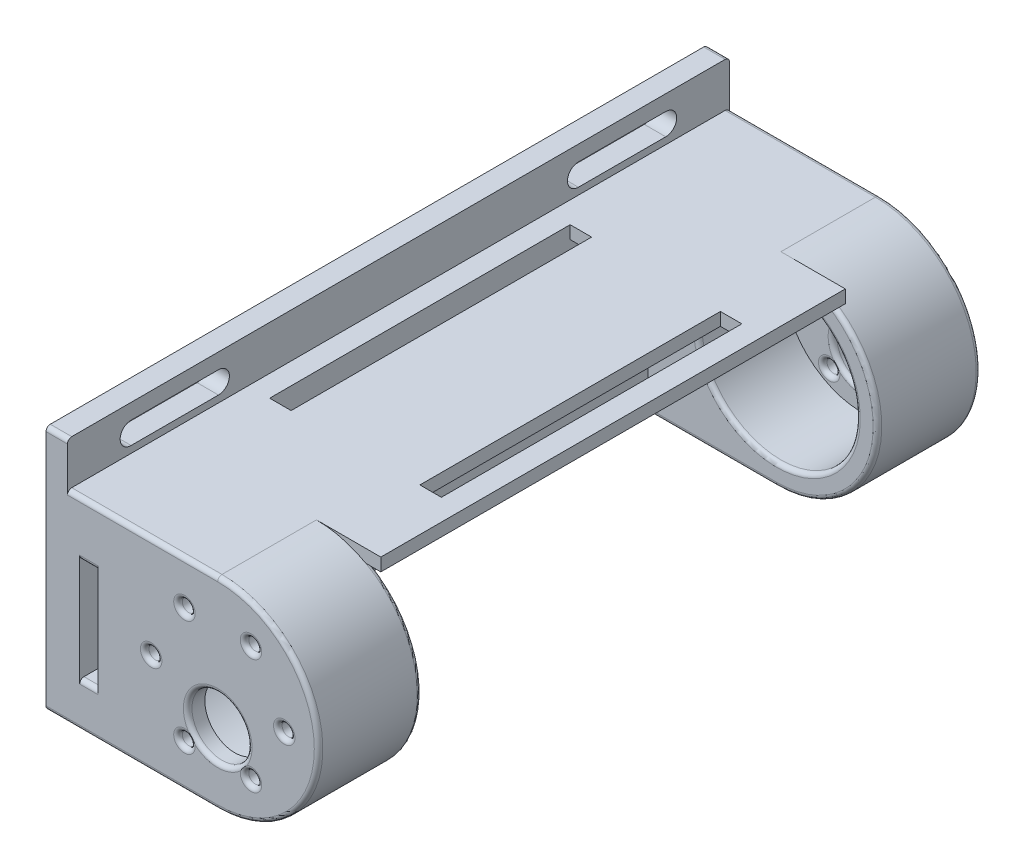
from build123d import *
from OCP.BRepFilletAPI import BRepFilletAPI_MakeChamfer

# Parameters (mm, degrees)
BOSS_EXTRUDE1_DEPTH = 20
BOSS_EXTRUDE2_START = 4
SKETCH1_3_R         = 7.0000000000000036
SKETCH1_3_R_2       = 1.5000000000000002
SKETCH1_3_R_3       = 1.5000000000000009
SKETCH1_3_R_4       = 1.5000000000000013
SKETCH1_3_R_5       = 1.500000000000008
SKETCH1_3_R_6       = 1.500000000000004
BOSS_EXTRUDE2_DEPTH = 4
BOSS_EXTRUDE3_DEPTH = 53.1
SKETCH5_W           = 20.000000000000007
SKETCH5_H           = 1.9999999999999991
SKETCH5_H_2         = 2.0000000000000018
SKETCH5_R           = 2.100000000000004
CUT_EXTRUDE1_DEPTH  = 20
FILLET1_R           = 1
CUT_EXTRUDE2_START  = -2.5
CUT_EXTRUDE2_DEPTH  = 22.5
FILLET2_R           = 1
FILLET3_R           = 1
BOSS_EXTRUDE5_START = -5
BOSS_EXTRUDE5_DEPTH = 5
CHAMFER1_SIZE       = 1.5
CHAMFER1_SIZE2      = 1.7876303888913219
BOSS_EXTRUDE6_DEPTH = 45
CUT_EXTRUDE3_DEPTH  = 3


# Read off the part's stored shape, not the designer's step: 37d-gearmotor-100-131-150-encoder.step
with BuildPart() as part:
    # Sketch1 → Boss-Extrude1 (new body)
    with BuildSketch(Plane.XY.offset(19.925000000000068)):
        with BuildLine():
            Line((-20.07500000000007, 23.500000000000004), (-20.07500000000007, -23.499999999999996))
            Line((-20.07500000000007, -23.499999999999996), (19.92499999999993, -23.500000000000004))
            ThreePointArc((19.924999999999926, -23.500000000000007), (-3.575000000000081, 6.35e-15), (19.92499999999992, 23.500000000000014))
            Line((19.924999999999923, 23.500000000000004), (-20.07500000000007, 23.500000000000004))
        make_face()
        with BuildLine():
            ThreePointArc((19.92499999999992, 23.500000000000014), (-3.575000000000081, 6.35e-15), (19.924999999999926, -23.500000000000007))
            Line((19.92499999999993, -23.500000000000004), (19.92499999999993, -18.500000000000004))
            ThreePointArc((19.92499999999945, -18.500000000000004), (1.4249999999999226, 5.74e-15), (19.924999999999464, 18.50000000000001))
            Line((19.924999999999923, 18.50000000000001), (19.924999999999923, 23.500000000000004))
        make_face()
        with BuildLine():
            Line((19.92499999999993, -18.500000000000004), (19.92499999999993, -23.500000000000004))
            ThreePointArc((19.924999999999926, -23.500000000000007), (36.5420093578838, -16.617009357883873), (43.42499999999994, -2.29e-15))
            ThreePointArc((43.42499999999994, 3.47e-15), (36.5420093578838, 16.61700935788388), (19.924999999999926, 23.500000000000014))
            Line((19.924999999999923, 23.500000000000004), (19.924999999999923, 18.50000000000001))
            ThreePointArc((19.924999999999464, 18.50000000000001), (33.0064754519509, 13.081475451951302), (38.42499999999994, 3.47e-15))
            ThreePointArc((38.42499999999994, -1.06e-15), (33.006475451950884, -13.081475451951308), (19.92499999999945, -18.500000000000004))
        make_face()
    extrude(amount=-BOSS_EXTRUDE1_DEPTH)

    # Sketch1<3> → Boss-Extrude2 (add)
    with BuildSketch(Plane.XY.offset(19.925000000000068).offset(BOSS_EXTRUDE2_START)):
        with BuildLine():
            Line((-20.07500000000007, 23.500000000000004), (-20.07500000000007, -23.499999999999996))
            Line((-20.07500000000007, -23.499999999999996), (19.92499999999993, -23.500000000000004))
            ThreePointArc((19.92499999999993, -23.500000000000007), (43.42499999999994, 7.25e-15), (19.924999999999923, 23.500000000000014))
            Line((19.924999999999923, 23.500000000000004), (-20.07500000000007, 23.500000000000004))
        make_face()
        with Locations((19.924999999999926, -7.000000000000003)):
            Circle(SKETCH1_3_R, mode=Mode.SUBTRACT)
        with Locations((12.175000000000061, 13.423393758658873)):
            Circle(SKETCH1_3_R_2, mode=Mode.SUBTRACT)
        with Locations((12.17499999999986, -13.42339375865876)):
            Circle(SKETCH1_3_R_3, mode=Mode.SUBTRACT)
        with Locations((4.424999999999929, 1.1319e-13)):
            Circle(SKETCH1_3_R_4, mode=Mode.SUBTRACT)
        with Locations((27.674999999999894, -13.423393758658815)):
            Circle(SKETCH1_3_R_5, mode=Mode.SUBTRACT)
        with Locations((35.424999999999926, 1.19e-15)):
            Circle(SKETCH1_3_R_6, mode=Mode.SUBTRACT)
        with Locations((27.67500000000009, 13.423393758658715)):
            Circle(SKETCH1_3_R_5, mode=Mode.SUBTRACT)
    extrude(amount=-BOSS_EXTRUDE2_DEPTH)

    # Sketch3 → Boss-Extrude3 (add)
    with BuildSketch(Plane(origin=(0, 0, -0.07499999999993276), x_dir=(-1, 0, 0), z_dir=(0, 0, -1))):
        Polygon((20.075000000000003, 23.500000000000004), (10.075000000000003, 23.500000000000004), (10.075000000000008, -23.499999999999996), (20.07500000000001, -23.499999999999996), align=None)
    extrude(amount=BOSS_EXTRUDE3_DEPTH)

    # Mirror12: part across plane


with BuildPart() as part_1:
    add(part.part)
    add(part.part.mirror(Plane(origin=(-1.8566e-13, 0, -53.17499999999993), x_dir=(1, 0, -3.49e-15), z_dir=(-3.49e-15, 0, -1))))

    # Sketch5 → Cut-Extrude1 (cut)
    with BuildSketch(Plane.ZY.offset(20.075000000000003)):
        with BuildLine():
            ThreePointArc((-117.17499999999998, 4.199999999999996), (-115.69007575950818, 4.8150757595082165), (-115.07499999999989, 6.299999999999999))
            Line((-115.07499999999989, 6.3), (-117.1749999999999, 6.3))
            Line((-117.1749999999999, 6.300000000000001), (-117.1749999999999, 4.199999999999996))
        make_face()
        with BuildLine():
            Line((-117.1749999999999, 6.3), (-115.07499999999989, 6.3))
            ThreePointArc((-115.07499999999989, 6.3), (-118.65992424049162, 7.784924240491783), (-117.17499999999998, 4.199999999999996))
            Line((-117.1749999999999, 4.199999999999996), (-117.1749999999999, 6.300000000000001))
        make_face()
        with BuildLine():
            ThreePointArc((12.9250000000001, 6.3), (10.825000000000099, 8.4), (8.725000000000097, 6.3))
            Line((8.725000000000094, 6.3), (10.825000000000102, 6.3))
            Line((10.825000000000099, 6.300000000000001), (10.825000000000099, 4.199999999999999))
            ThreePointArc((10.82500000000018, 4.199999999999999), (12.309924240491878, 4.815075759508279), (12.9250000000001, 6.299999999999999))
        make_face()
        with BuildLine():
            Line((10.825000000000102, 6.3), (8.725000000000094, 6.3))
            ThreePointArc((8.725000000000097, 6.3), (9.340075759508377, 4.815075759508221), (10.82500000000018, 4.199999999999999))
            Line((10.825000000000099, 4.199999999999999), (10.825000000000099, 6.300000000000001))
        make_face()
        with BuildLine():
            ThreePointArc((12.9250000000001, -8.7), (12.309924240491878, -7.215075759508277), (10.825000000000179, -6.599999999999998))
            Line((10.825000000000099, -6.599999999999998), (10.825000000000099, -8.7))
            Line((10.825000000000102, -8.7), (8.725000000000094, -8.7))
            ThreePointArc((8.725000000000097, -8.7), (10.825000000000099, -10.8), (12.9250000000001, -8.7))
        make_face()
        with BuildLine():
            Line((10.825000000000099, -8.7), (10.825000000000099, -6.599999999999998))
            ThreePointArc((10.825000000000179, -6.599999999999998), (9.340075759508377, -7.21507575950822), (8.725000000000097, -8.7))
            Line((8.725000000000094, -8.7), (10.825000000000102, -8.7))
        make_face()
        Polygon((-43.17499999999989, 8.3), (-63.1749999999999, 8.3), (-63.17499999999989, 6.3), (-43.1749999999999, 6.3), align=None)
        Polygon((-43.1749999999999, 6.3), (-63.17499999999989, 6.3), (-63.17499999999988, 4.3), (-43.17499999999989, 4.3), align=None)
        with Locations((-53.1749999999999, -7.699999999999999)):
            Rectangle(SKETCH5_W, SKETCH5_H)
        with Locations((-53.1749999999999, -9.7)):
            Rectangle(SKETCH5_W, SKETCH5_H_2)
        with Locations((-117.1749999999999, -8.7)):
            Circle(SKETCH5_R)
    extrude(amount=-CUT_EXTRUDE1_DEPTH, mode=Mode.SUBTRACT)

    # Fillet1
    # the kernel refuses this fillet: 1 mm, written as the material it adds along each edge
    with BuildSketch(Plane(origin=(-20.075000000000003, -6.700000000000001, -43.1749999999999), x_dir=(0, -1, 0), z_dir=(1, 0, 0)), Plane(origin=(-20.075000000000003, -10.700000000000001, -63.1749999999999), x_dir=(0, 1, 0), z_dir=(1, 0, 0))) as fillet1_piece_1:
        with BuildLine():
            CenterArc((FILLET1_R, FILLET1_R), FILLET1_R, 180, 90)
            Line((0, FILLET1_R), (0, 0))
            Line((0, 0), (FILLET1_R, 0))
        make_face()
    extrude(amount=9.999999999999996)
    with BuildSketch(Plane(origin=(-20.075000000000003, -10.700000000000001, -43.1749999999999), x_dir=(0, 0, -1), z_dir=(1, 0, 0))) as fillet1_piece_2:
        with BuildLine():
            CenterArc((FILLET1_R, FILLET1_R), FILLET1_R, 180, 90)
            Line((0, FILLET1_R), (0, 0))
            Line((0, 0), (FILLET1_R, 0))
        make_face()
    extrude(amount=9.999999999999996)
    with BuildSketch(Plane(origin=(-20.075000000000003, -6.700000000000001, -63.1749999999999), x_dir=(0, -1, 0), z_dir=(1, 0, 0))) as fillet1_piece_3:
        with BuildLine():
            CenterArc((FILLET1_R, -FILLET1_R), FILLET1_R, 90, 90)
            Line((0, -FILLET1_R), (0, 0))
            Line((0, 0), (FILLET1_R, 0))
        make_face()
    extrude(amount=9.999999999999996)
    with BuildSketch(Plane(origin=(-20.075000000000003, 8.3, -43.17499999999989), x_dir=(0, -1, 0), z_dir=(1, 0, 0))) as fillet1_piece_4:
        with BuildLine():
            CenterArc((FILLET1_R, FILLET1_R), FILLET1_R, 180, 90)
            Line((0, FILLET1_R), (0, 0))
            Line((0, 0), (FILLET1_R, 0))
        make_face()
    extrude(amount=9.999999999999998)
    with BuildSketch(Plane(origin=(-20.075000000000003, 4.3, -43.17499999999989), x_dir=(0, 1, 0), z_dir=(1, 0, 0))) as fillet1_piece_5:
        with BuildLine():
            CenterArc((FILLET1_R, -FILLET1_R), FILLET1_R, 90, 90)
            Line((0, -FILLET1_R), (0, 0))
            Line((0, 0), (FILLET1_R, 0))
        make_face()
    extrude(amount=9.999999999999998)
    with BuildSketch(Plane(origin=(-20.075000000000003, 4.3, -63.17499999999988), x_dir=(0, 1, 0), z_dir=(1, 0, 0))) as fillet1_piece_6:
        with BuildLine():
            CenterArc((FILLET1_R, FILLET1_R), FILLET1_R, 180.0000000000004, 89.99999999999943)
            Line((8.9e-16, FILLET1_R), (0, 0))
            Line((0, 0), (FILLET1_R, 0))
        make_face()
    extrude(amount=9.999999999999998)
    with BuildSketch(Plane(origin=(-20.075000000000003, 8.3, -63.1749999999999), x_dir=(0, 0, 1), z_dir=(1, 0, 0))) as fillet1_piece_7:
        with BuildLine():
            CenterArc((FILLET1_R, FILLET1_R), FILLET1_R, 179.99999999999986, 90.00000000000011)
            Line((0, FILLET1_R), (0, 0))
            Line((0, 0), (FILLET1_R, 0))
        make_face()
    extrude(amount=9.999999999999998)
    # the kernel refuses this fillet: 1 mm, written as the material it takes off along each edge
    with BuildSketch(Plane(origin=(35.425, 1.19e-15, 19.925000000000068), x_dir=(1, 0, 0), z_dir=(0, -1, 0))) as fillet1_2_piece_1:
        with BuildLine():
            CenterArc((1.500000000000007 + FILLET1_R, FILLET1_R), FILLET1_R, 180, 90)
            Line((1.500000000000007 + FILLET1_R, 0), (1.500000000000007, 0))
            Line((1.500000000000007, 0), (1.500000000000007, FILLET1_R))
        make_face()
    revolve(axis=Axis((35.425, 1.19e-15, 19.925000000000068), (0, 0, 1)), mode=Mode.SUBTRACT)
    with BuildSketch(Plane(origin=(27.674999999999965, -13.423393758658815, 19.925000000000068), x_dir=(1, 0, 0), z_dir=(0, -1, 0))) as fillet1_2_piece_2:
        with BuildLine():
            CenterArc((1.500000000000007 + FILLET1_R, FILLET1_R), FILLET1_R, 180, 90)
            Line((1.500000000000007 + FILLET1_R, 0), (1.500000000000007, 0))
            Line((1.500000000000007, 0), (1.500000000000007, FILLET1_R))
        make_face()
    revolve(axis=Axis((27.674999999999965, -13.423393758658815, 19.925000000000068), (0, 0, 1)), mode=Mode.SUBTRACT)
    with BuildSketch(Plane(origin=(27.67500000000016, 13.423393758658715, 19.925000000000068), x_dir=(1, 0, 0), z_dir=(0, -1, 0))) as fillet1_2_piece_3:
        with BuildLine():
            CenterArc((1.500000000000007 + FILLET1_R, FILLET1_R), FILLET1_R, 180, 90)
            Line((1.500000000000007 + FILLET1_R, 0), (1.500000000000007, 0))
            Line((1.500000000000007, 0), (1.500000000000007, FILLET1_R))
        make_face()
    revolve(axis=Axis((27.67500000000016, 13.423393758658715, 19.925000000000068), (0, 0, 1)), mode=Mode.SUBTRACT)
    with BuildSketch(Plane(origin=(4.424999999999998, 1.1319e-13, 19.925000000000068), x_dir=(1, 0, 0), z_dir=(0, -1, 0))) as fillet1_2_piece_4:
        with BuildLine():
            CenterArc((1.5000000000000009 + FILLET1_R, FILLET1_R), FILLET1_R, 180, 90)
            Line((1.5000000000000009 + FILLET1_R, 0), (1.5000000000000009, 0))
            Line((1.5000000000000009, 0), (1.5000000000000009, FILLET1_R))
        make_face()
    revolve(axis=Axis((4.424999999999998, 1.1319e-13, 19.925000000000068), (0, 0, 1)), mode=Mode.SUBTRACT)
    with BuildSketch(Plane(origin=(12.17500000000013, 13.423393758658873, 19.925000000000068), x_dir=(1, 0, 0), z_dir=(0, -1, 0))) as fillet1_2_piece_5:
        with BuildLine():
            CenterArc((1.5 + FILLET1_R, FILLET1_R), FILLET1_R, 180, 90)
            Line((1.5 + FILLET1_R, 0), (1.5, 0))
            Line((1.5, 0), (1.5, FILLET1_R))
        make_face()
    revolve(axis=Axis((12.17500000000013, 13.423393758658873, 19.925000000000068), (0, 0, 1)), mode=Mode.SUBTRACT)
    with BuildSketch(Plane(origin=(19.924999999999994, 23.500000000000004, 23.925000000000068), x_dir=(0, 0, -1), z_dir=(-1, 0, 0))) as fillet1_2_piece_6:
        with BuildLine():
            CenterArc((FILLET1_R, FILLET1_R), FILLET1_R, 180, 90)
            Line((0, FILLET1_R), (0, 0))
            Line((0, 0), (FILLET1_R, 0))
        make_face()
    extrude(amount=42.49999999999999, mode=Mode.SUBTRACT)
    with BuildSketch(Plane(origin=(27.674999999999965, -13.423393758658815, 23.925000000000068), x_dir=(1, 0, 0), z_dir=(0, -1, 0))) as fillet1_2_piece_7:
        with BuildLine():
            CenterArc((1.500000000000007 + FILLET1_R, -FILLET1_R), FILLET1_R, 90, 90)
            Line((1.500000000000007, -FILLET1_R), (1.500000000000007, 0))
            Line((1.500000000000007, 0), (1.500000000000007 + FILLET1_R, 0))
        make_face()
    revolve(axis=Axis((27.674999999999965, -13.423393758658815, 23.925000000000068), (0, 0, 1)), mode=Mode.SUBTRACT)
    with BuildSketch(Plane(origin=(27.67500000000016, 13.423393758658715, 23.925000000000068), x_dir=(1, 0, 0), z_dir=(0, -1, 0))) as fillet1_2_piece_8:
        with BuildLine():
            CenterArc((1.500000000000007 + FILLET1_R, -FILLET1_R), FILLET1_R, 90, 90)
            Line((1.500000000000007, -FILLET1_R), (1.500000000000007, 0))
            Line((1.500000000000007, 0), (1.500000000000007 + FILLET1_R, 0))
        make_face()
    revolve(axis=Axis((27.67500000000016, 13.423393758658715, 23.925000000000068), (0, 0, 1)), mode=Mode.SUBTRACT)
    with BuildSketch(Plane(origin=(12.17499999999993, -13.42339375865876, 23.925000000000068), x_dir=(1, 0, 0), z_dir=(0, -1, 0))) as fillet1_2_piece_9:
        with BuildLine():
            CenterArc((1.5000000000000018 + FILLET1_R, -FILLET1_R), FILLET1_R, 90, 90)
            Line((1.5000000000000018, -FILLET1_R), (1.5000000000000018, 0))
            Line((1.5000000000000018, 0), (1.5000000000000018 + FILLET1_R, 0))
        make_face()
    revolve(axis=Axis((12.17499999999993, -13.42339375865876, 23.925000000000068), (0, 0, 1)), mode=Mode.SUBTRACT)
    with BuildSketch(Plane(origin=(4.424999999999998, 1.1319e-13, 23.925000000000068), x_dir=(1, 0, 0), z_dir=(0, -1, 0))) as fillet1_2_piece_10:
        with BuildLine():
            CenterArc((1.5000000000000009 + FILLET1_R, -FILLET1_R), FILLET1_R, 90, 90)
            Line((1.5000000000000009, -FILLET1_R), (1.5000000000000009, 0))
            Line((1.5000000000000009, 0), (1.5000000000000009 + FILLET1_R, 0))
        make_face()
    revolve(axis=Axis((4.424999999999998, 1.1319e-13, 23.925000000000068), (0, 0, 1)), mode=Mode.SUBTRACT)
    with BuildSketch(Plane(origin=(12.17500000000013, 13.423393758658873, 23.925000000000068), x_dir=(1, 0, 0), z_dir=(0, -1, 0))) as fillet1_2_piece_11:
        with BuildLine():
            CenterArc((1.5 + FILLET1_R, -FILLET1_R), FILLET1_R, 90, 90)
            Line((1.5, -FILLET1_R), (1.5, 0))
            Line((1.5, 0), (1.5 + FILLET1_R, 0))
        make_face()
    revolve(axis=Axis((12.17500000000013, 13.423393758658873, 23.925000000000068), (0, 0, 1)), mode=Mode.SUBTRACT)
    with BuildSketch(Plane(origin=(19.924999999999997, -7.000000000000003, 23.925000000000068), x_dir=(1, 0, 0), z_dir=(0, -1, 0))) as fillet1_2_piece_12:
        with BuildLine():
            CenterArc((7.000000000000007 + FILLET1_R, -FILLET1_R), FILLET1_R, 90, 90)
            Line((7.000000000000007, -FILLET1_R), (7.000000000000007, 0))
            Line((7.000000000000007, 0), (7.000000000000007 + FILLET1_R, 0))
        make_face()
    revolve(axis=Axis((19.924999999999997, -7.000000000000003, 23.925000000000068), (0, 0, 1)), mode=Mode.SUBTRACT)
    with BuildSketch(Plane(origin=(35.425, 1.19e-15, 23.925000000000068), x_dir=(1, 0, 0), z_dir=(0, -1, 0))) as fillet1_2_piece_13:
        with BuildLine():
            CenterArc((1.500000000000007 + FILLET1_R, -FILLET1_R), FILLET1_R, 90, 90)
            Line((1.500000000000007, -FILLET1_R), (1.500000000000007, 0))
            Line((1.500000000000007, 0), (1.500000000000007 + FILLET1_R, 0))
        make_face()
    revolve(axis=Axis((35.425, 1.19e-15, 23.925000000000068), (0, 0, 1)), mode=Mode.SUBTRACT)
    with BuildSketch(Plane(origin=(19.925000000000004, 2.66e-15, 23.925000000000068), x_dir=(-1.5e-16, -1, 0), z_dir=(-1, 1.5e-16, 0))) as fillet1_2_piece_14:
        with BuildLine():
            CenterArc((23.500000000000007 - FILLET1_R, -FILLET1_R), FILLET1_R, 0, 90)
            Line((23.500000000000007, -FILLET1_R), (23.500000000000007, 0))
            Line((23.500000000000007, 0), (23.500000000000007 - FILLET1_R, 0))
        make_face()
    revolve(axis=Axis((19.925000000000004, 2.66e-15, 23.925000000000068), (0, 0, 1)), revolution_arc=180.00000000000003, mode=Mode.SUBTRACT)
    with BuildSketch(Plane(origin=(-22.575, -23.499999999999996, 23.925000000000068), x_dir=(1.8e-16, 1, 0), z_dir=(1, -1.8e-16, 0))) as fillet1_2_piece_15:
        with BuildLine():
            CenterArc((FILLET1_R, -FILLET1_R), FILLET1_R, 90, 90)
            Line((0, -FILLET1_R), (0, 0))
            Line((0, 0), (FILLET1_R, 0))
        make_face()
    extrude(amount=42.5, mode=Mode.SUBTRACT)
    with BuildSketch(Plane(origin=(19.924999999999997, -7.11e-15, -0.07499999999993179), x_dir=(-1.248e-14, -1, 0), z_dir=(-1, 1.248e-14, 0))) as fillet1_2_piece_16:
        with BuildLine():
            CenterArc((18.500000000000014 + FILLET1_R, FILLET1_R), FILLET1_R, 180, 90)
            Line((18.500000000000014, FILLET1_R), (18.500000000000014, 0))
            Line((18.500000000000014, 0), (18.500000000000014 + FILLET1_R, 0))
        make_face()
    revolve(axis=Axis((19.924999999999997, -7.11e-15, -0.07499999999993179), (0, 0, 1)), mode=Mode.SUBTRACT)
    with BuildSketch(Plane(origin=(-10.07500000000001, -23.499999999999996, -0.07499999999993179), x_dir=(1.8e-16, 1, 0), z_dir=(1, -1.8e-16, 0))) as fillet1_2_piece_17:
        with BuildLine():
            CenterArc((FILLET1_R, FILLET1_R), FILLET1_R, 180, 90)
            Line((0, FILLET1_R), (0, 0))
            Line((0, 0), (FILLET1_R, 0))
        make_face()
    extrude(amount=30.00000000000001, mode=Mode.SUBTRACT)
    with BuildSketch(Plane(origin=(19.924999999999994, 23.500000000000004, -0.07499999999993179), x_dir=(0, 0, 1), z_dir=(-1, 0, 0))) as fillet1_2_piece_18:
        with BuildLine():
            CenterArc((FILLET1_R, -FILLET1_R), FILLET1_R, 90, 90)
            Line((0, -FILLET1_R), (0, 0))
            Line((0, 0), (FILLET1_R, 0))
        make_face()
    extrude(amount=30, mode=Mode.SUBTRACT)
    with BuildSketch(Plane(origin=(19.924999999999997, 9.77e-15, -0.07499999999993179), x_dir=(0, -1, 0), z_dir=(-1, 0, 0))) as fillet1_2_piece_19:
        with BuildLine():
            CenterArc((23.500000000000014 - FILLET1_R, FILLET1_R), FILLET1_R, 270, 90)
            Line((23.500000000000014, FILLET1_R), (23.500000000000014, 0))
            Line((23.500000000000014, 0), (23.500000000000014 - FILLET1_R, 0))
        make_face()
    revolve(axis=Axis((19.924999999999997, 9.77e-15, -0.07499999999993179), (0, 0, 1)), revolution_arc=180, mode=Mode.SUBTRACT)
    with BuildSketch(Plane(origin=(-10.07500000000038, -23.499999999999996, -106.27499999999986), x_dir=(1.8e-16, 1, -1.421e-14), z_dir=(1, -1.8e-16, -6.98e-15))) as fillet1_2_piece_20:
        with BuildLine():
            CenterArc((FILLET1_R, -FILLET1_R), FILLET1_R, 90.00000000000081, 89.99999999999919)
            Line((1.421e-14, -FILLET1_R), (0, 0))
            Line((0, 0), (FILLET1_R, 0))
        make_face()
    extrude(amount=30.00000000000001, mode=Mode.SUBTRACT)
    with BuildSketch(Plane(origin=(19.924999999999624, 9.77e-15, -106.27500000000008), x_dir=(0, -1, 0), z_dir=(-1, 0, 6.98e-15))) as fillet1_2_piece_21:
        with BuildLine():
            CenterArc((23.500000000000018 - FILLET1_R, -FILLET1_R), FILLET1_R, 359.9999999999992, 90.0000000000008)
            Line((23.500000000000018, -FILLET1_R), (23.500000000000018, 0))
            Line((23.500000000000018, 0), (23.500000000000018 - FILLET1_R, 0))
        make_face()
    revolve(axis=Axis((19.924999999999624, 9.77e-15, -106.27500000000008), (6.98e-15, 0, 1)), revolution_arc=180, mode=Mode.SUBTRACT)
    with BuildSketch(Plane(origin=(19.924999999999464, 2.66e-15, -130.27500000000006), x_dir=(-1.5e-16, -1, 0), z_dir=(-1, 1.5e-16, 6.98e-15))) as fillet1_2_piece_22:
        with BuildLine():
            CenterArc((23.500000000000007 - FILLET1_R, FILLET1_R), FILLET1_R, 269.9999999999996, 90.0000000000004)
            Line((23.500000000000007 - FILLET1_R, 0), (23.500000000000007, 0))
            Line((23.500000000000007, 0), (23.500000000000014, FILLET1_R))
        make_face()
    revolve(axis=Axis((19.924999999999464, 2.66e-15, -130.27500000000006), (6.98e-15, 0, 1)), revolution_arc=180.00000000000003, mode=Mode.SUBTRACT)
    with BuildSketch(Plane(origin=(-22.57500000000054, -23.499999999999996, -130.27499999999975), x_dir=(1.8e-16, 1, 0), z_dir=(1, -1.8e-16, -6.98e-15))) as fillet1_2_piece_23:
        with BuildLine():
            CenterArc((FILLET1_R, FILLET1_R), FILLET1_R, 180, 90)
            Line((0, FILLET1_R), (0, 0))
            Line((0, 0), (FILLET1_R, 0))
        make_face()
    extrude(amount=42.5, mode=Mode.SUBTRACT)
    with BuildSketch(Plane(origin=(19.924999999999624, 23.500000000000004, -106.27500000000008), x_dir=(-6.98e-15, 0, -1), z_dir=(-1, 0, 6.98e-15))) as fillet1_2_piece_24:
        with BuildLine():
            CenterArc((FILLET1_R, FILLET1_R), FILLET1_R, 180, 90)
            Line((0, FILLET1_R), (0, 0))
            Line((0, 0), (FILLET1_R, 0))
        make_face()
    extrude(amount=30, mode=Mode.SUBTRACT)
    with BuildSketch(Plane(origin=(19.924999999999624, -7.11e-15, -106.27500000000008), x_dir=(-1.248e-14, -1, 0), z_dir=(-1, 1.248e-14, 6.98e-15))) as fillet1_2_piece_25:
        with BuildLine():
            CenterArc((18.500000000000014 + FILLET1_R, -FILLET1_R), FILLET1_R, 90, 90)
            Line((18.500000000000014, -FILLET1_R), (18.500000000000014, 0))
            Line((18.500000000000014, 0), (18.500000000000014 + FILLET1_R, 0))
        make_face()
    revolve(axis=Axis((19.924999999999624, -7.11e-15, -106.27500000000008), (6.98e-15, 0, 1)), mode=Mode.SUBTRACT)
    with BuildSketch(Plane(origin=(27.674999999999454, -13.423393758658815, -126.27500000000012), x_dir=(1, 0, 0), z_dir=(0, -1, 0))) as fillet1_2_piece_26:
        with BuildLine():
            CenterArc((1.500000000000007 + FILLET1_R, -FILLET1_R), FILLET1_R, 89.99999999999959, 89.9999999999996)
            Line((1.500000000000007 + FILLET1_R, -2.842e-14), (1.500000000000007, -1.421e-14))
            Line((1.500000000000007, -1.421e-14), (1.5, -FILLET1_R))
        make_face()
    revolve(axis=Axis((27.674999999999454, -13.423393758658815, -126.27500000000012), (6.98e-15, 0, 1)), mode=Mode.SUBTRACT)
    with BuildSketch(Plane(origin=(27.67499999999965, 13.423393758658715, -126.27500000000012), x_dir=(1, 0, 0), z_dir=(0, -1, 0))) as fillet1_2_piece_27:
        with BuildLine():
            CenterArc((1.500000000000007 + FILLET1_R, -FILLET1_R), FILLET1_R, 89.99999999999959, 89.9999999999996)
            Line((1.500000000000007 + FILLET1_R, -2.842e-14), (1.500000000000007, -1.421e-14))
            Line((1.500000000000007, -1.421e-14), (1.5, -FILLET1_R))
        make_face()
    revolve(axis=Axis((27.67499999999965, 13.423393758658715, -126.27500000000012), (6.98e-15, 0, 1)), mode=Mode.SUBTRACT)
    with BuildSketch(Plane(origin=(12.17499999999942, -13.42339375865876, -126.275), x_dir=(1, 0, 0), z_dir=(0, -1, 0))) as fillet1_2_piece_28:
        with BuildLine():
            CenterArc((1.5 + FILLET1_R, -FILLET1_R), FILLET1_R, 89.99999999999959, 89.9999999999996)
            Line((1.5 + FILLET1_R, -2.842e-14), (1.5, -1.421e-14))
            Line((1.5, -1.421e-14), (1.4999999999999947, -FILLET1_R))
        make_face()
    revolve(axis=Axis((12.17499999999942, -13.42339375865876, -126.275), (6.98e-15, 0, 1)), mode=Mode.SUBTRACT)
    with BuildSketch(Plane(origin=(4.424999999999487, 1.1319e-13, -126.27499999999995), x_dir=(1, 0, 0), z_dir=(0, -1, 0))) as fillet1_2_piece_29:
        with BuildLine():
            CenterArc((1.5000000000000009 + FILLET1_R, -FILLET1_R), FILLET1_R, 89.99999999999964, 89.99999999999955)
            Line((1.5000000000000009 + FILLET1_R, -2.842e-14), (1.5000000000000009, -1.421e-14))
            Line((1.5000000000000009, -1.421e-14), (1.4999999999999938, -FILLET1_R))
        make_face()
    revolve(axis=Axis((4.424999999999487, 1.1319e-13, -126.27499999999995), (6.98e-15, 0, 1)), mode=Mode.SUBTRACT)
    with BuildSketch(Plane(origin=(12.17499999999962, 13.423393758658873, -126.275), x_dir=(1, 0, 0), z_dir=(0, -1, 0))) as fillet1_2_piece_30:
        with BuildLine():
            CenterArc((1.5 + FILLET1_R, -FILLET1_R), FILLET1_R, 89.99999999999959, 89.9999999999996)
            Line((1.5 + FILLET1_R, -2.842e-14), (1.5, -1.421e-14))
            Line((1.5, -1.421e-14), (1.499999999999993, -FILLET1_R))
        make_face()
    revolve(axis=Axis((12.17499999999962, 13.423393758658873, -126.275), (6.98e-15, 0, 1)), mode=Mode.SUBTRACT)
    with BuildSketch(Plane(origin=(19.924999999999486, -7.000000000000003, -126.27500000000006), x_dir=(1, 0, -8.12e-15), z_dir=(0, -1, 0))) as fillet1_2_piece_31:
        with BuildLine():
            CenterArc((7.000000000000007 + FILLET1_R, -FILLET1_R), FILLET1_R, 89.9999999999999, 89.99999999999977)
            Line((7.000000000000007 + FILLET1_R, -6.09e-15), (7.000000000000007, 1.421e-14))
            Line((7.000000000000007, 1.421e-14), (7.000000000000004, -FILLET1_R))
        make_face()
    revolve(axis=Axis((19.924999999999486, -7.000000000000003, -126.27500000000006), (6.98e-15, 0, 1)), mode=Mode.SUBTRACT)
    with BuildSketch(Plane(origin=(35.424999999999486, 1.19e-15, -126.27500000000018), x_dir=(1, 0, 0), z_dir=(0, -1, 0))) as fillet1_2_piece_32:
        with BuildLine():
            CenterArc((1.500000000000007 + FILLET1_R, -FILLET1_R), FILLET1_R, 89.99999999999959, 89.9999999999996)
            Line((1.500000000000007 + FILLET1_R, -2.842e-14), (1.500000000000007, -1.421e-14))
            Line((1.500000000000007, -1.421e-14), (1.5, -FILLET1_R))
        make_face()
    revolve(axis=Axis((35.424999999999486, 1.19e-15, -126.27500000000018), (6.98e-15, 0, 1)), mode=Mode.SUBTRACT)
    with BuildSketch(Plane(origin=(19.924999999999457, -7.000000000000003, -130.27500000000006), x_dir=(1, 0, -8.12e-15), z_dir=(0, -1, 0))) as fillet1_2_piece_33:
        with BuildLine():
            CenterArc((7.000000000000007 + FILLET1_R, FILLET1_R), FILLET1_R, 179.99999999999886, 90.00000000000125)
            Line((7.000000000000006, FILLET1_R), (7.000000000000007, 2.842e-14))
            Line((7.000000000000007, 2.842e-14), (7.000000000000007 + FILLET1_R, 8.12e-15))
        make_face()
    revolve(axis=Axis((19.924999999999457, -7.000000000000003, -130.27500000000006), (6.98e-15, 0, 1)), mode=Mode.SUBTRACT)
    with BuildSketch(Plane(origin=(19.924999999999454, 23.500000000000004, -130.27500000000006), x_dir=(6.98e-15, 0, 1), z_dir=(-1, 0, 6.98e-15))) as fillet1_2_piece_34:
        with BuildLine():
            CenterArc((FILLET1_R, -FILLET1_R), FILLET1_R, 90, 90)
            Line((0, -FILLET1_R), (0, 0))
            Line((0, 0), (FILLET1_R, 0))
        make_face()
    extrude(amount=42.49999999999999, mode=Mode.SUBTRACT)
    with BuildSketch(Plane(origin=(12.174999999999592, 13.423393758658873, -130.275), x_dir=(1, 0, 0), z_dir=(0, -1, 0))) as fillet1_2_piece_35:
        with BuildLine():
            CenterArc((1.5 + FILLET1_R, FILLET1_R), FILLET1_R, 180, 89.9999999999996)
            Line((1.500000000000007, FILLET1_R), (1.5, -2.842e-14))
            Line((1.5, -2.842e-14), (1.5 + FILLET1_R, -2.842e-14))
        make_face()
    revolve(axis=Axis((12.174999999999592, 13.423393758658873, -130.275), (6.98e-15, 0, 1)), mode=Mode.SUBTRACT)
    with BuildSketch(Plane(origin=(4.42499999999946, 1.1319e-13, -130.27499999999995), x_dir=(1, 0, 0), z_dir=(0, -1, 0))) as fillet1_2_piece_36:
        with BuildLine():
            CenterArc((1.5000000000000009 + FILLET1_R, FILLET1_R), FILLET1_R, 180, 89.9999999999996)
            Line((1.500000000000008, FILLET1_R), (1.5000000000000009, -2.842e-14))
            Line((1.5000000000000009, -2.842e-14), (1.5000000000000009 + FILLET1_R, -2.842e-14))
        make_face()
    revolve(axis=Axis((4.42499999999946, 1.1319e-13, -130.27499999999995), (6.98e-15, 0, 1)), mode=Mode.SUBTRACT)
    with BuildSketch(Plane(origin=(12.174999999999391, -13.42339375865876, -130.275), x_dir=(1, 0, 0), z_dir=(0, -1, 0))) as fillet1_2_piece_37:
        with BuildLine():
            CenterArc((1.5 + FILLET1_R, FILLET1_R), FILLET1_R, 180, 89.9999999999996)
            Line((1.500000000000007, FILLET1_R), (1.5, -2.842e-14))
            Line((1.5, -2.842e-14), (1.5 + FILLET1_R, -2.842e-14))
        make_face()
    revolve(axis=Axis((12.174999999999391, -13.42339375865876, -130.275), (6.98e-15, 0, 1)), mode=Mode.SUBTRACT)
    with BuildSketch(Plane(origin=(27.67499999999962, 13.423393758658715, -130.27500000000012), x_dir=(1, 0, 0), z_dir=(0, -1, 0))) as fillet1_2_piece_38:
        with BuildLine():
            CenterArc((1.500000000000007 + FILLET1_R, FILLET1_R), FILLET1_R, 180.00000000000327, 89.9999999999963)
            Line((1.5000000000000142, FILLET1_R), (1.500000000000007, -2.842e-14))
            Line((1.500000000000007, -2.842e-14), (1.500000000000007 + FILLET1_R, 0))
        make_face()
    revolve(axis=Axis((27.67499999999962, 13.423393758658715, -130.27500000000012), (6.98e-15, 0, 1)), mode=Mode.SUBTRACT)
    with BuildSketch(Plane(origin=(27.674999999999425, -13.423393758658815, -130.27500000000012), x_dir=(1, 0, 0), z_dir=(0, -1, 0))) as fillet1_2_piece_39:
        with BuildLine():
            CenterArc((1.500000000000007 + FILLET1_R, FILLET1_R), FILLET1_R, 180.00000000000327, 89.9999999999963)
            Line((1.5000000000000142, FILLET1_R), (1.500000000000007, -2.842e-14))
            Line((1.500000000000007, -2.842e-14), (1.500000000000007 + FILLET1_R, 0))
        make_face()
    revolve(axis=Axis((27.674999999999425, -13.423393758658815, -130.27500000000012), (6.98e-15, 0, 1)), mode=Mode.SUBTRACT)
    with BuildSketch(Plane(origin=(35.42499999999946, 1.19e-15, -130.27500000000018), x_dir=(1, 0, 0), z_dir=(0, -1, 0))) as fillet1_2_piece_40:
        with BuildLine():
            CenterArc((1.500000000000007 + FILLET1_R, FILLET1_R), FILLET1_R, 180.00000000000327, 89.9999999999963)
            Line((1.5000000000000142, FILLET1_R), (1.500000000000007, -2.842e-14))
            Line((1.500000000000007, -2.842e-14), (1.500000000000007 + FILLET1_R, 0))
        make_face()
    revolve(axis=Axis((35.42499999999946, 1.19e-15, -130.27500000000018), (6.98e-15, 0, 1)), mode=Mode.SUBTRACT)

    # Sketch7 → Cut-Extrude2 (cut)
    with BuildSketch(Plane(origin=(0, 0, -115.0749999999999), x_dir=(-1, 0, 0), z_dir=(0, 0, -1)).offset(CUT_EXTRUDE2_START)):
        Polygon((7.925000000000001, 7.299999999999992), (12.225, 7.299999999999993), (12.225, 10.799999999999994), (7.925, 10.799999999999994), align=None)
        Polygon((12.225, -9.700000000000003), (12.225, 7.299999999999994), (7.925000000000001, 7.299999999999992), (7.925, -9.700000000000006), align=None)
        Polygon((12.225, -13.200000000000006), (12.225, -9.700000000000003), (7.925000000000001, -9.700000000000005), (7.925, -13.200000000000006), align=None)
    cut_extrude2 = extrude(amount=CUT_EXTRUDE2_DEPTH, mode=Mode.SUBTRACT)

    # Fillet2
    fillet2_edges = [part_1.edges().sort_by_distance(p)[0] for p in [
        (-10.075, 10.799999999999994, -130.27499999999986),
        (-10.075, -13.200000000000006, -130.27499999999986),
        (-10.075, -13.200000000000006, -112.5749999999999),
        (-10.075, 10.799999999999994, -112.5749999999999),
    ]]
    fillet(fillet2_edges, radius=FILLET2_R)

    # Mirror14: Cut-Extrude2 across plane
    add(cut_extrude2.mirror(Plane(origin=(-1.8566e-13, 0, -53.17499999999993), x_dir=(1, 0, -3.49e-15), z_dir=(-3.49e-15, 0, -1))), mode=Mode.SUBTRACT)

    # Fillet3
    fillet3_edges = [part_1.edges().sort_by_distance(p)[0] for p in [
        (-10.074999999999461, -13.200000000000006, 23.925000000000068),
        (-10.07499999999946, 10.799999999999994, 23.925000000000068),
        (-10.074999999999584, 10.799999999999994, 6.225000000000108),
        (-10.074999999999585, -13.200000000000006, 6.225000000000108),
    ]]
    fillet(fillet3_edges, radius=FILLET3_R)

    # Sketch11 → Boss-Extrude5 (add)
    with BuildSketch(Plane.ZY.offset(20.075000000000003).offset(BOSS_EXTRUDE5_START)):
        with BuildLine():
            Line((-130.27499999999978, 32.8), (-130.27499999999978, 22.500000000000004))
            ThreePointArc((-130.275, 22.5), (-129.98210678118656, 23.20710678118655), (-129.275, 23.500000000000004))
            Line((-129.27499999999978, 23.500000000000004), (22.925000000000068, 23.500000000000004))
            ThreePointArc((22.925, 23.5), (23.632106781186547, 23.207106781186546), (23.925, 22.5))
            Line((23.925000000000068, 22.500000000000004), (23.925000000000068, 32.8))
            ThreePointArc((23.925000000000068, 32.8), (23.632106781186614, 33.50710678118655), (22.92500000000006, 33.800000000000004))
            Line((22.925000000000068, 33.800000000000004), (-129.27499999999978, 33.800000000000004))
            ThreePointArc((-129.27499999999978, 33.80000000000001), (-129.98210678118633, 33.50710678118655), (-130.27499999999978, 32.8))
        make_face()
        with BuildLine():
            ThreePointArc((-115.44999999999979, 25.099999999999977), (-117.9999999999998, 27.650000000000006), (-115.44999999999979, 30.200000000000035))
            Line((-115.44999999999979, 30.200000000000035), (-95.09999999999978, 30.20000000000004))
            ThreePointArc((-95.09999999999978, 30.200000000000042), (-92.54999999999973, 27.65000000000001), (-95.09999999999978, 25.099999999999977))
            Line((-95.09999999999978, 25.09999999999998), (-115.44999999999979, 25.099999999999977))
        make_face(mode=Mode.SUBTRACT)
        with BuildLine():
            Line((-11.249999999999929, 30.20000000000005), (9.10000000000008, 30.20000000000005))
            ThreePointArc((9.10000000000008, 30.20000000000005), (11.650000000000096, 27.65000000000002), (9.10000000000008, 25.09999999999999))
            Line((9.10000000000008, 25.09999999999999), (-11.249999999999929, 25.09999999999999))
            ThreePointArc((-11.249999999999927, 25.09999999999999), (-13.799999999999972, 27.65000000000002), (-11.249999999999927, 30.20000000000005))
        make_face(mode=Mode.SUBTRACT)
    extrude(amount=BOSS_EXTRUDE5_DEPTH)

    # Chamfer1: one chamfer whose edges measure the first distance from different faces: ONE call of the kernel's chamfer builder (chamfer() names one face for all edges)
    chamfer1_edges_1 = [part_1.edges().sort_by_distance(p)[0] for p in [
        (-0.07500000000000284, -8.7, -119.2749999999999),
    ]]
    chamfer1_side_1 = [part_1.faces().sort_by_distance(p)[0] for p in [
        (-4, -8.7, -119.2749999999999),
    ]]
    chamfer1_edges_2 = [part_1.edges().sort_by_distance(p)[0] for p in [
        (-0.07500000000000284, -8.700000000000003, 8.72500000000009),
    ]]
    chamfer1_side_2 = [part_1.faces().sort_by_distance(p)[0] for p in [
        (-3.9999999999997797, -8.700000000000001, 8.725000000000097),
    ]]
    chamfer1_edges_3 = [part_1.edges().sort_by_distance(p)[0] for p in [
        (-0.07500000000000284, 6.300000000000002, 12.9250000000001),
    ]]
    chamfer1_side_3 = [part_1.faces().sort_by_distance(p)[0] for p in [
        (-3.999999999999787, 6.3000000000000025, 12.9250000000001),
    ]]
    chamfer1_edges_4 = [part_1.edges().sort_by_distance(p)[0] for p in [
        (-0.07500000000000284, 8.400000000000011, -117.17499999999981),
    ]]
    chamfer1_side_4 = [part_1.faces().sort_by_distance(p)[0] for p in [
        (-4, 8.400000000000011, -117.17499999999981),
    ]]
    chamfer1 = BRepFilletAPI_MakeChamfer(part_1.part.solid().wrapped)
    for e in chamfer1_edges_1:
        chamfer1.Add(CHAMFER1_SIZE, CHAMFER1_SIZE2, e.wrapped, chamfer1_side_1[0].wrapped)  # the first distance lies on this face
    for e in chamfer1_edges_2:
        chamfer1.Add(CHAMFER1_SIZE, CHAMFER1_SIZE2, e.wrapped, chamfer1_side_2[0].wrapped)  # the first distance lies on this face
    for e in chamfer1_edges_3:
        chamfer1.Add(CHAMFER1_SIZE, CHAMFER1_SIZE2, e.wrapped, chamfer1_side_3[0].wrapped)  # the first distance lies on this face
    for e in chamfer1_edges_4:
        chamfer1.Add(CHAMFER1_SIZE, CHAMFER1_SIZE2, e.wrapped, chamfer1_side_4[0].wrapped)  # the first distance lies on this face
    add(Compound.cast(chamfer1.Shape()), mode=Mode.REPLACE)

    # Sketch12 → Boss-Extrude6 (add)
    with BuildSketch(Plane(origin=(-10.075000000000006, 1.12e-15, 0), x_dir=(0, 0, -1), z_dir=(1, -1.1e-16, 0))):
        Polygon((-0.9250000000000708, 23.500000000000004), (107.27500000000006, 23.500000000000004), (107.27500000000006, 20.500000000000004), (-0.925000000000067, 20.500000000000004), align=None)
    extrude(amount=BOSS_EXTRUDE6_DEPTH)

    # Sketch13 → Cut-Extrude3 (cut)
    with BuildSketch(Plane(origin=(0, 23.500000000000004, 0), x_dir=(1, 0, 0), z_dir=(0, 1, 0))):
        Polygon((24.924999999999994, 88.175), (24.92500000000001, 18.174999999999997), (29.92500000000002, 18.174999999999997), (29.92500000000002, 88.175), align=None)
        Polygon((-10.075000000000031, 88.175), (-10.075000000000019, 18.174999999999997), (-5.075000000000017, 18.174999999999997), (-5.075000000000034, 88.175), align=None)
    extrude(amount=-CUT_EXTRUDE3_DEPTH, mode=Mode.SUBTRACT)


solid = part_1.part
